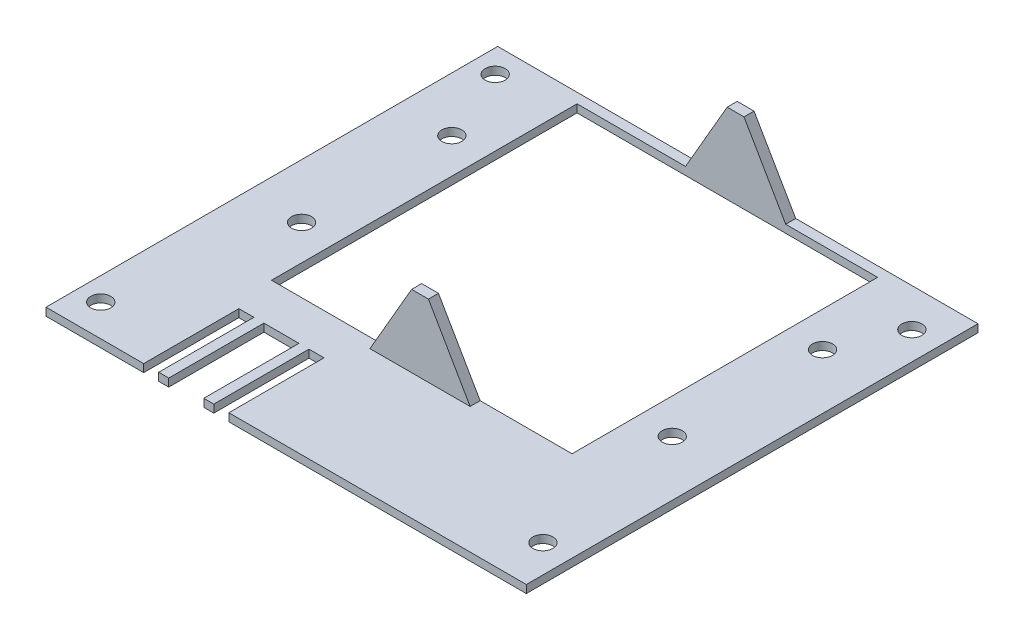
from build123d import *

# Parameters (mm, degrees)
SKETCH1_W               = 96.89
SKETCH1_H               = 90.17
PCB_DEPTH               = 1.57
SKETCH2_R               = 2
M3_MOUNTING_HOLES_DEPTH = 1.57
SKETCH4_R               = 2
CUT_EXTRUDE1_DEPTH      = 23
BOSS_EXTRUDE2_DEPTH     = 2
BOSS_EXTRUDE3_DEPTH     = 2
SKETCH9_W               = 3
SKETCH9_H               = 19
SKETCH9_W_2             = 7
CUT_EXTRUDE2_DEPTH      = 128.304608561
SKETCH10_W              = 0.5
SKETCH10_H              = 90.17
CUT_EXTRUDE3_DEPTH      = 10
SKETCH11_W              = 60
SKETCH11_H              = 61
CUT_EXTRUDE4_DEPTH      = 10


with BuildPart() as part:
    # Sketch1 → PCB (new body)
    with BuildSketch(Plane(origin=(0, 0, 0), x_dir=(1, 0, 0), z_dir=(0, 1, 0))):
        with Locations((16.200949951, 63.633996534)):
            Rectangle(SKETCH1_W, SKETCH1_H)
    extrude(amount=PCB_DEPTH)

    # Sketch2 → M3 Mounting Holes (cut)
    with BuildSketch(Plane(origin=(0, 1.57, 0), x_dir=(1, 0, 0), z_dir=(0, 1, 0))):
        with Locations((58.565949951, 27.438996534)):
            Circle(SKETCH2_R)
        with Locations((-27.164050049, 24.898996534)):
            Circle(SKETCH2_R)
        with Locations((-27.164050049, 103.638996534)):
            Circle(SKETCH2_R)
        with Locations((58.565949951, 101.098996534)):
            Circle(SKETCH2_R)
    extrude(amount=-M3_MOUNTING_HOLES_DEPTH, mode=Mode.SUBTRACT)

    # Sketch4 → Cut-Extrude1 (cut)
    with BuildSketch(Plane(origin=(0, 1.57, 0), x_dir=(1, 0, 0), z_dir=(0, 1, 0))):
        with Locations((-20.894050049, 88.718996534)):
            Circle(SKETCH4_R)
        with Locations((53.105949951, 88.718996534)):
            Circle(SKETCH4_R)
        with Locations((-20.894050049, 58.718996534)):
            Circle(SKETCH4_R)
        with Locations((53.105949951, 58.718996534)):
            Circle(SKETCH4_R)
    extrude(amount=-CUT_EXTRUDE1_DEPTH, mode=Mode.SUBTRACT)

    # Sketch7 → Boss-Extrude2 (add)
    with BuildSketch(Plane.XY.offset(-45.718996534)):
        Polygon((27.755949951, 1.57), (19.438412086, 15.976398176), (16.073487816, 15.976398176), (7.755949951, 1.57), align=None)
    extrude(amount=BOSS_EXTRUDE2_DEPTH)

    # Sketch8 → Boss-Extrude3 (add)
    with BuildSketch(Plane.XY.offset(-108.718996534)):
        Polygon((27.755949951, 1.57), (19.438412086, 15.976398176), (16.073487816, 15.976398176), (7.755949951, 1.57), align=None)
    extrude(amount=BOSS_EXTRUDE3_DEPTH)

    # Sketch9 → Cut-Extrude2 (cut, through all)
    with BuildSketch(Plane(origin=(0, 1.57, 0), x_dir=(1, 0, 0), z_dir=(0, 1, 0))):
        with Locations((-10.744050049, 28.048996534)):
            Rectangle(SKETCH9_W, SKETCH9_H)
        with Locations((-3.744050049, 28.048996534)):
            Rectangle(SKETCH9_W_2, SKETCH9_H)
        with Locations((3.255949951, 28.048996534)):
            Rectangle(SKETCH9_W, SKETCH9_H)
    extrude(amount=-CUT_EXTRUDE2_DEPTH, mode=Mode.SUBTRACT)

    # Sketch10 → Cut-Extrude3 (cut)
    with BuildSketch(Plane(origin=(0, 1.57, 0), x_dir=(1, 0, 0), z_dir=(0, 1, 0))):
        with Locations((-31.994050049, 63.633996534)):
            Rectangle(SKETCH10_W, SKETCH10_H)
        with Locations((64.395949951, 63.633996534)):
            Rectangle(SKETCH10_W, SKETCH10_H)
    extrude(amount=-CUT_EXTRUDE3_DEPTH, mode=Mode.SUBTRACT)

    # Sketch11 → Cut-Extrude4 (cut)
    with BuildSketch(Plane(origin=(0, 1.57, 0), x_dir=(1, 0, 0), z_dir=(0, 1, 0))):
        with Locations((16.105949951, 76.218996534)):
            Rectangle(SKETCH11_W, SKETCH11_H)
    extrude(amount=-CUT_EXTRUDE4_DEPTH, mode=Mode.SUBTRACT)


solid = part.part
